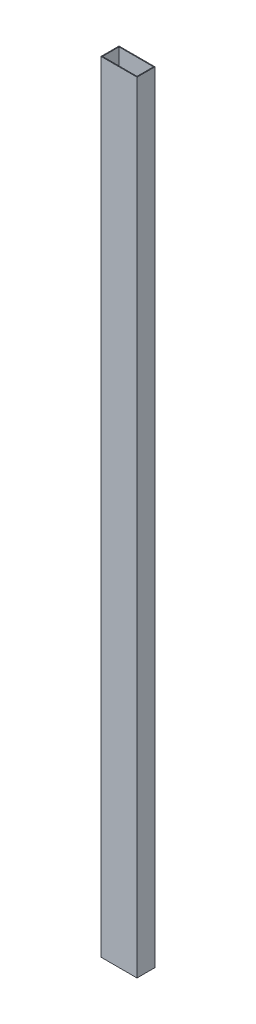
from build123d import *

# Parameters (mm, degrees)
SKETCH1_W           = 76.2
SKETCH1_H           = 38.1
SKETCH1_W_2         = 73.025
SKETCH1_H_2         = 34.925
BOSS_EXTRUDE1_DEPTH = 1651


with BuildPart() as part:
    # Sketch1 → Boss-Extrude1 (new body)
    with BuildSketch(Plane(origin=(0, 0, 0), x_dir=(1, 0, 0), z_dir=(0, 1, 0))):
        with Locations((-38.1, 19.05)):
            Rectangle(SKETCH1_W, SKETCH1_H)
        with Locations((-38.1, 19.05)):
            Rectangle(SKETCH1_W_2, SKETCH1_H_2, mode=Mode.SUBTRACT)
    extrude(amount=BOSS_EXTRUDE1_DEPTH)


solid = part.part
